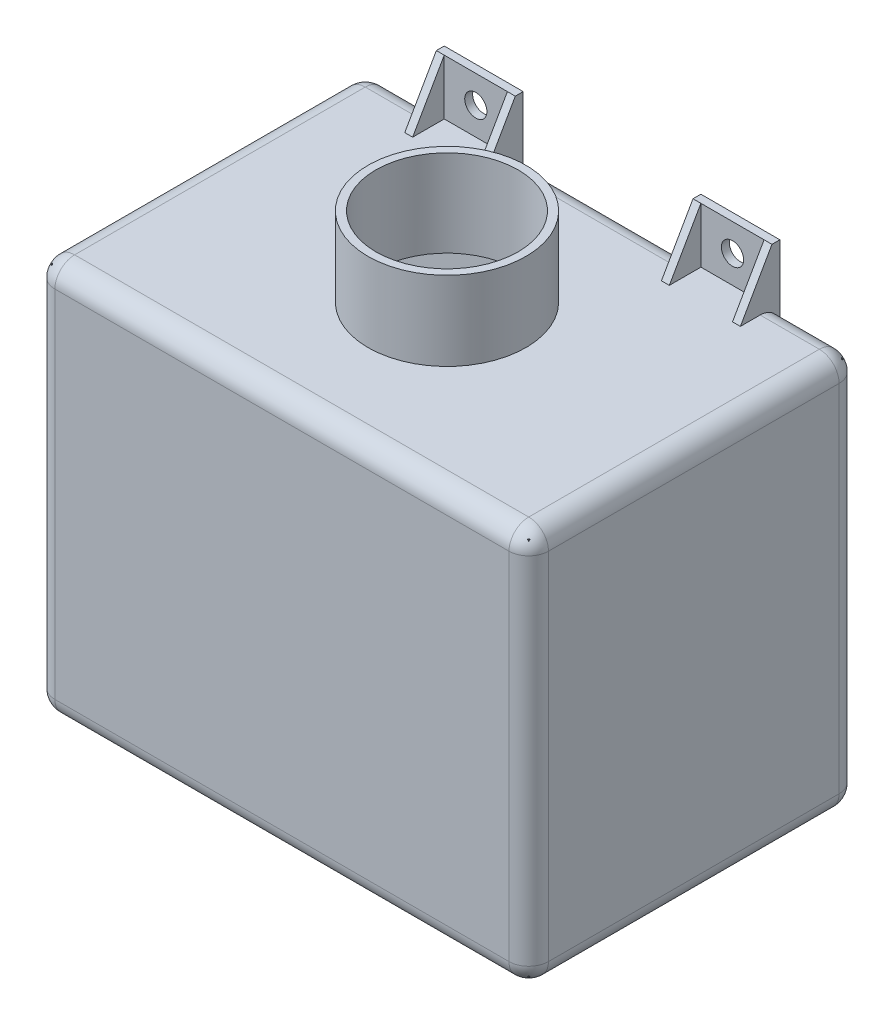
from build123d import *

# Parameters (mm, degrees)
SKETCH1_W               = 158.75
SKETCH1_H               = 106.172
BOSS_EXTRUDE1_DEPTH     = 127
SKETCH2_R               = 25.4
BOSS_EXTRUDE2_DEPTH     = 25.4
SKETCH8_R               = 6.35
BOSS_EXTRUDE5_DEPTH     = 30.48
BOSS_EXTRUDE3_DEPTH     = 17.78
CUT_EXTRUDE2_DEPTH      = 196.580989608
CUT_EXTRUDE2_DEPTH_BACK = 196.580989608
BOSS_EXTRUDE4_DEPTH     = 30.48
SHELL1_START            = 2.54
SHELL1_OUTLINE_W        = 153.67
SHELL1_OUTLINE_H        = 101.092
SHELL1_DEPTH            = 121.92
SHELL1_START_2          = 124.46
SHELL1_2_OUTLINE_R      = 22.86
SHELL1_2_DEPTH          = 27.94
SHELL1_START_3          = -30.48
SHELL1_3_OUTLINE_R      = 3.81
SHELL1_3_DEPTH          = 33.02
CUT_EXTRUDE4_DEPTH      = 186.800131919
CUT_EXTRUDE4_DEPTH_BACK = 186.800131919
F_1_4_CLEARANCE_HOLE1_D = 7.14248
FILLET1_R               = 6.35


# Read off the part's stored shape, not the designer's step: Shell1
with BuildPart() as part:
    # Sketch1 → Boss-Extrude1 (new body)
    with BuildSketch(Plane(origin=(0, 0, 0), x_dir=(1, 0, 0), z_dir=(0, 1, 0))):
        Rectangle(SKETCH1_W, SKETCH1_H)
    extrude(amount=BOSS_EXTRUDE1_DEPTH)

    # Sketch2 → Boss-Extrude2 (add)
    with BuildSketch(Plane(origin=(0, 127, 0), x_dir=(1, 0, 0), z_dir=(0, 1, 0))):
        with Locations(Location((0, 0, 0), (0, 0, 270))):
            Circle(SKETCH2_R)
    extrude(amount=BOSS_EXTRUDE2_DEPTH)

    # Sketch8 → Boss-Extrude5 (add)
    with BuildSketch(Plane.XZ):
        with Locations(Location((15.875, 0, 0), (0, 0, 90))):
            Circle(SKETCH8_R)
    extrude(amount=BOSS_EXTRUDE5_DEPTH)

    # Sketch3 → Boss-Extrude3 (add)
    with BuildSketch(Plane(origin=(0, 127, 0), x_dir=(1, 0, 0), z_dir=(0, 1, 0))):
        Polygon((-53.975, 53.086), (-53.975, 40.386), (-51.435, 40.386), (-51.435, 50.546), (-31.115, 50.546), (-31.115, 40.386), (-28.575, 40.386), (-28.575, 53.086), align=None)
        Polygon((28.575, 53.086), (53.975, 53.086), (53.975, 40.386), (51.435, 40.386), (51.435, 50.546), (31.115, 50.546), (31.115, 40.386), (28.575, 40.386), align=None)
    extrude(amount=BOSS_EXTRUDE3_DEPTH)

    # Sketch5 → Cut-Extrude2 (cut, two sides: drawn at the far end of the back side and taken through both)
    with BuildSketch(Plane(origin=(31.115, 0, 0), x_dir=(0, 0, -1), z_dir=(1, 0, 0)).offset(-CUT_EXTRUDE2_DEPTH_BACK)):
        Polygon((40.386, 127), (50.546, 144.78), (40.386, 144.78), align=None)
    extrude(amount=CUT_EXTRUDE2_DEPTH + CUT_EXTRUDE2_DEPTH_BACK, mode=Mode.SUBTRACT)

    # Sketch7 → Boss-Extrude4 (add)
    with BuildSketch(Plane.XZ):
        Polygon((-15.24, -40.386), (-15.24, -53.086), (15.24, -53.086), (15.24, -40.386), (12.7, -40.386), (12.7, -50.546), (-12.7, -50.546), (-12.7, -40.386), align=None)
    extrude(amount=BOSS_EXTRUDE4_DEPTH)

    # Shell1 outline → Shell1 (cut)
    with BuildSketch(Plane(origin=(0, 0, 0), x_dir=(1, 0, 0), z_dir=(0, 1, 0)).offset(SHELL1_START)):
        Rectangle(SHELL1_OUTLINE_W, SHELL1_OUTLINE_H)
    extrude(amount=SHELL1_DEPTH, mode=Mode.SUBTRACT)

    # Shell1 2 outline → Shell1 2 (cut)
    with BuildSketch(Plane(origin=(0, 0, 0), x_dir=(1, 0, 0), z_dir=(0, 1, 0)).offset(SHELL1_START_2)):
        Circle(SHELL1_2_OUTLINE_R)
    extrude(amount=SHELL1_2_DEPTH, mode=Mode.SUBTRACT)

    # Shell1 3 outline → Shell1 3 (cut)
    with BuildSketch(Plane(origin=(0, 0, 0), x_dir=(1, 0, 0), z_dir=(0, 1, 0)).offset(SHELL1_START_3)):
        with Locations((15.875, 0)):
            Circle(SHELL1_3_OUTLINE_R)
    extrude(amount=SHELL1_3_DEPTH, mode=Mode.SUBTRACT)

    # Sketch9 → Cut-Extrude4 (cut, two sides: drawn at the far end of the back side and taken through both)
    with BuildSketch(Plane(origin=(-12.7, 0, 0), x_dir=(0, 0, -1), z_dir=(1, 0, 0)).offset(-CUT_EXTRUDE4_DEPTH_BACK)):
        Polygon((40.386, 0), (50.546, -30.48), (40.386, -30.48), align=None)
    extrude(amount=CUT_EXTRUDE4_DEPTH + CUT_EXTRUDE4_DEPTH_BACK, mode=Mode.SUBTRACT)

    # 1/4 Clearance Hole1 (through all)
    with Locations(Plane(origin=(-41.275, 135.89, -50.546), x_dir=(1, 0, 0), z_dir=(0, 0, 1))):
        with Locations((0, 0), (82.55, 0), (41.275, -156.21)):
            Hole(F_1_4_CLEARANCE_HOLE1_D / 2)

    # Fillet1
    fillet1_edges = [part.edges().sort_by_distance(p)[0] for p in [
        (-47.3075, 0, -53.086),
        (79.375, 127, 0),
        (66.675, 127, -53.086),
        (-66.675, 127, -53.086),
        (0, 127, -53.086),
        (-79.375, 127, 0),
        (47.3075, 0, -53.086),
        (79.375, 0, 0),
        (0, 0, 53.086),
        (-79.375, 0, 0),
        (-79.375, 63.5, -53.086),
        (79.375, 63.5, -53.086),
        (79.375, 63.5, 53.086),
        (-79.375, 63.5, 53.086),
        (0, 127, 53.086),
    ]]
    fillet(fillet1_edges, radius=FILLET1_R)


solid = part.part
